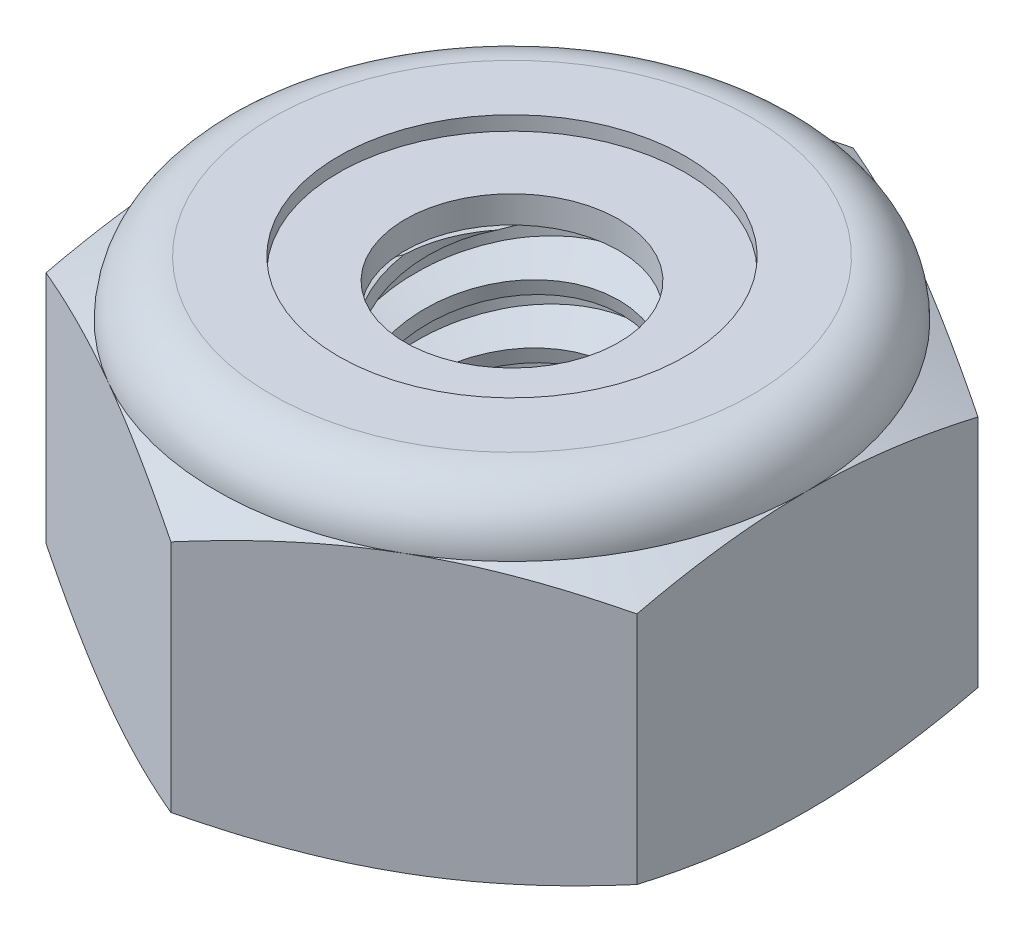
from build123d import *

# Parameters (mm, degrees)
EXTRUDE1_DEPTH       = 3.571875
SKETCH2_W            = 1.4224
SKETCH2_H            = 3.571875
LPATTERN1_COUNT      = 6
LPATTERN1_PITCH      = 0.635
LPATTERN1_COUNT_DIR2 = 2
LPATTERN1_PITCH_DIR2 = 0.635


with BuildPart() as part:
    # Sketch1 → Extrude1 (new body)
    with BuildSketch(Plane(origin=(0, 0, 0), x_dir=(1, 0, 0), z_dir=(0, 1, 0))):
        Polygon((0, 3.666174209), (-3.175, 1.833087105), (-3.175, -1.833087105), (0, -3.666174209), (3.175, -1.833087105), (3.175, 1.833087105), align=None)
    extrude(amount=EXTRUDE1_DEPTH)

    # Sketch4 → Cut-Revolve2 (revolve, cut)
    with BuildSketch(Plane(origin=(0, 0, 0), x_dir=(0, 0, -1), z_dir=(1, 0, 0))):
        Polygon((0, 3.571875), (1.4224, 3.571875), (1.147473684, 3.443674754), (1.147473684, 0.128200246), (1.4224, 0), (0, 0), align=None)
    revolve(axis=Axis((0, 3.571875, 0), (0, 1, 0)), mode=Mode.SUBTRACT)


with BuildPart() as body_2:
    # Sketch2 → Revolve1 (revolve)
    with BuildSketch(Plane(origin=(0, 0, 0), x_dir=(0, 0, -1), z_dir=(1, 0, 0))):
        with Locations((0.7112, 1.7859375)):
            Rectangle(SKETCH2_W, SKETCH2_H)
    revolve(axis=Axis((0, -1.4224, 0), (0, 1, 0)))

    # Sketch3 → Cut-Revolve1 (revolve, cut)
    with BuildSketch(Plane(origin=(0, 0, 0), x_dir=(0, 0, -1), z_dir=(1, 0, 0))):
        Polygon((1.439692084, 3.494406462), (1.560736676, 2.952126693), (1.182057853, 3.070921117), (1.147473684, 3.225858194), align=None)
    cut_revolve1 = revolve(axis=Axis((0, 3.571875, 0.152561988), (0, -0.9759815859905213, -0.21785303258717037)), mode=Mode.SUBTRACT)

    # LPattern1: Cut-Revolve1 6 × 2
    with Locations(*[Vector(0, -1, 0) * (i * LPATTERN1_PITCH) + Vector(0, 1, 0) * (j * LPATTERN1_PITCH_DIR2) for i in range(LPATTERN1_COUNT) for j in range(LPATTERN1_COUNT_DIR2) if (i, j) != (0, 0)]):
        add(cut_revolve1, mode=Mode.SUBTRACT)


with BuildPart() as part_1:
    add(part.part)

    # Combine1: cut body 2
    add(body_2.part, mode=Mode.SUBTRACT)

    # Sketch5 → Cut-Revolve3 (revolve, cut)
    with BuildSketch(Plane(origin=(0, 0, 0), x_dir=(0, 0, -1), z_dir=(1, 0, 0))):
        with BuildLine():
            Line((0, 0), (3.175, 0))
            Line((3.175, 0), (3.666174209, 0.229038295))
            Line((3.666174209, 0.229038295), (3.666174209, 2.747524205))
            Line((3.666174209, 2.747524205), (3.175, 2.9765625))
            ThreePointArc((3.175, 2.9765625), (3.000637006, 3.397512006), (2.5796875, 3.571875))
            Line((2.5796875, 3.571875), (2.5796875, 4.841875))
            Line((2.5796875, 4.841875), (4.936174209, 4.841875))
            Line((4.936174209, 4.841875), (4.936174209, -1.27))
            Line((4.936174209, -1.27), (0, -1.27))
            Line((0, -1.27), (0, 0))
        make_face()
    revolve(axis=Axis((0, 0, 0), (0, 1, 0)), mode=Mode.SUBTRACT)

    # Sketch6 → Cut-Revolve4 (revolve, cut)
    with BuildSketch(Plane(origin=(0, 0, 0), x_dir=(0, 0, -1), z_dir=(1, 0, 0))):
        with BuildLine():
            Line((0, 2.9765625), (3.0226, 2.9765625))
            ThreePointArc((3.0226, 2.9765625), (2.892873932, 3.289748932), (2.5796875, 3.419475))
            Line((2.5796875, 3.419475), (1.863580592, 3.419475))
            Line((1.863580592, 3.419475), (1.863580592, 4.841875))
            Line((1.863580592, 4.841875), (0, 4.841875))
            Line((0, 4.841875), (0, 2.9765625))
        make_face()
    revolve(axis=Axis((0, 4.841875, 0), (0, 1, 0)), mode=Mode.SUBTRACT)


with BuildPart() as body_2_2:
    # Sketch7 → Revolve2 (revolve)
    with BuildSketch(Plane(origin=(0, 0, 0), x_dir=(0, 0, -1), z_dir=(1, 0, 0))):
        with BuildLine():
            Line((1.147473684, 3.0527625), (2.938395763, 3.0527625))
            ThreePointArc((2.938395763, 3.0527625), (2.810484559, 3.261537543), (2.5796875, 3.343275))
            Line((2.5796875, 3.343275), (1.147473684, 3.343275))
            Line((1.147473684, 3.343275), (1.147473684, 3.0527625))
        make_face()
    revolve(axis=Axis((0, 3.0527625, 0), (0, 1, 0)))


solid = Compound([part_1.part, body_2_2.part])
